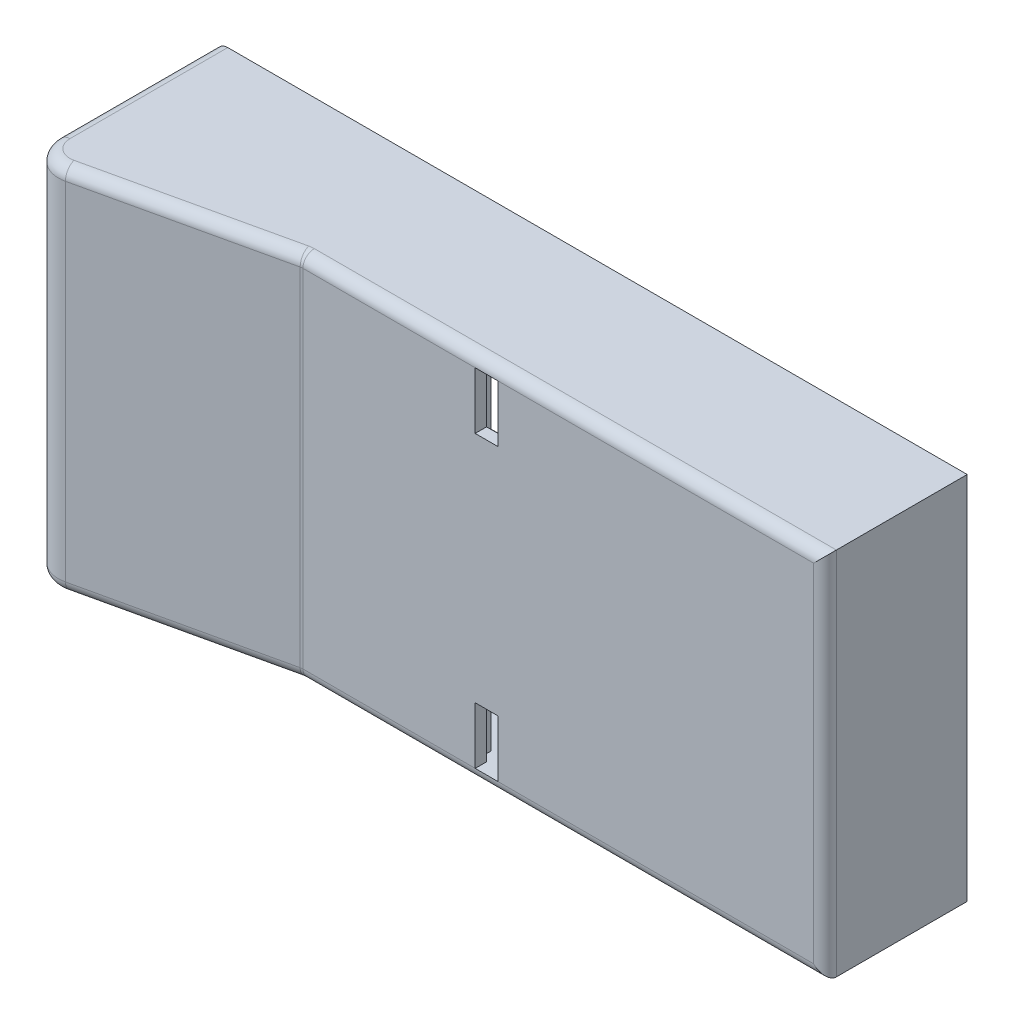
from build123d import *

# Parameters (mm, degrees)
BOSS_EXTRUDE3_DEPTH = 65
BOSS_EXTRUDE4_REACH = 153.013
SKETCH4_W           = 128
SKETCH4_H           = 2
SKETCH5_W           = 12
SKETCH5_H           = 53.559358602
CUT_EXTRUDE2_DEPTH  = 11
FILLET1_R           = 5
FILLET2_R           = 2
SKETCH7_W           = 90
SKETCH7_H           = 61
BOSS_EXTRUDE5_DEPTH = 2
BOSS_EXTRUDE6_DEPTH = 5
SKETCH12_R          = 1.5
CUT_EXTRUDE5_DEPTH  = 20
BOSS_EXTRUDE7_START = 13
BOSS_EXTRUDE7_DEPTH = 13
SKETCH15_R          = 1.5
CUT_EXTRUDE6_DEPTH  = 21
SKETCH16_W          = 6.5
SKETCH16_H          = 61
CUT_EXTRUDE7_DEPTH  = 2
FILLET3_R           = 3
FILLET4_R           = 3
CUT_EXTRUDE9_DEPTH  = 2
SKETCH18_W          = 6.5
SKETCH18_H          = 37.103743482
BOSS_EXTRUDE8_DEPTH = 2


with BuildPart() as part:
    # Sketch3 → Boss-Extrude3 (new body)
    with BuildSketch(Plane(origin=(0, 0, 0), x_dir=(1, 0, 0), z_dir=(0, 1, 0))):
        Polygon((0, 0), (0, 25), (-2, 25), (-2, 2), (-92, 2), (-130, -6.55), (-130, 25), (-132, 25), (-132, -9), (-92, 0), align=None)
    extrude(amount=BOSS_EXTRUDE3_DEPTH)

    # Sketch4 → Boss-Extrude4 (add, up to next)
    with BuildSketch(Plane(origin=(0, 0, -25), x_dir=(-1, 0, 0), z_dir=(0, 0, -1)), mode=Mode.PRIVATE) as boss_extrude4_sk1:
        with Locations((66, 64)):
            Rectangle(SKETCH4_W, SKETCH4_H)
    boss_extrude4_tool1 = extrude(boss_extrude4_sk1.sketch, amount=-BOSS_EXTRUDE4_REACH, mode=Mode.PRIVATE) - part.part
    # Sketch4 → Boss-Extrude4 (add, up to next)
    with BuildSketch(Plane(origin=(0, 0, -25), x_dir=(-1, 0, 0), z_dir=(0, 0, -1)), mode=Mode.PRIVATE) as boss_extrude4_sk2:
        with Locations((66, 1)):
            Rectangle(SKETCH4_W, SKETCH4_H)
    boss_extrude4_tool2 = extrude(boss_extrude4_sk2.sketch, amount=-BOSS_EXTRUDE4_REACH, mode=Mode.PRIVATE) - part.part
    add(boss_extrude4_tool1.solids().sort_by_distance((-66, 64, -25))[0])
    add(boss_extrude4_tool2.solids().sort_by_distance((-66, 1, -25))[0])

    # Sketch5 → Cut-Extrude2 (cut)
    with BuildSketch(Plane.ZY.offset(132)):
        with Locations((-14, 32.5)):
            Rectangle(SKETCH5_W, SKETCH5_H)
    extrude(amount=-CUT_EXTRUDE2_DEPTH, mode=Mode.SUBTRACT)

    # Fillet1
    fillet1_edges = [part.edges().sort_by_distance(p)[0] for p in [
        (-132, 32.5, 9),
    ]]
    fillet(fillet1_edges, radius=FILLET1_R)

    # Fillet2
    fillet2_edges = [part.edges().sort_by_distance(p)[0] for p in [
        (-132, 0, -11.125),
        (-46, 0, 0),
        (-92, 32.5, 0),
        (0, 32.5, 0),
        (-132, 65, -11.125),
        (-46, 65, 0),
        (-108.951219512, 0, 3.81402439),
        (-108.951219512, 65, 3.81402439),
        (-130.123475238, 0, 6.654344047),
        (-130.123475238, 65, 6.654344047),
    ]]
    fillet(fillet2_edges, radius=FILLET2_R)

    # Sketch7 → Boss-Extrude5 (add)
    with BuildSketch(Plane(origin=(0, 0, -2), x_dir=(-1, 0, 0), z_dir=(0, 0, -1))):
        with Locations((47, 32.5)):
            Rectangle(SKETCH7_W, SKETCH7_H)
    extrude(amount=BOSS_EXTRUDE5_DEPTH)

    # Sketch11 → Boss-Extrude6 (add)
    with BuildSketch(Plane(origin=(0, 0, -25), x_dir=(-1, 0, 0), z_dir=(0, 0, -1))):
        with BuildLine():
            Line((7, 63), (2, 63))
            Line((2, 63), (2, 58))
            ThreePointArc((2, 58), (5.535533906, 59.464466094), (7, 63))
        make_face()
        with BuildLine():
            Line((2, 7), (2, 2))
            Line((2, 2), (7, 2))
            ThreePointArc((7, 2), (5.535533906, 5.535533906), (2, 7))
        make_face()
        with BuildLine():
            Line((125, 2), (130, 2))
            Line((130, 2), (130, 7))
            ThreePointArc((130, 7), (126.464466094, 5.535533906), (125, 2))
        make_face()
        with BuildLine():
            Line((125, 63), (130, 63))
            Line((130, 63), (130, 58))
            ThreePointArc((130, 58), (126.464466094, 59.464466094), (125, 63))
        make_face()
    extrude(amount=-BOSS_EXTRUDE6_DEPTH)

    # Sketch12 → Cut-Extrude5 (cut)
    with BuildSketch(Plane(origin=(0, 0, -25), x_dir=(-1, 0, 0), z_dir=(0, 0, -1))):
        with Locations((3.767766953, 61.232233047)):
            Circle(SKETCH12_R)
        with Locations((128.232233047, 61.232233047)):
            Circle(SKETCH12_R)
        with Locations((128.232233047, 3.767766953)):
            Circle(SKETCH12_R)
        with Locations((3.767766953, 3.767766953)):
            Circle(SKETCH12_R)
    extrude(amount=-CUT_EXTRUDE5_DEPTH, mode=Mode.SUBTRACT)

    # Sketch14 → Boss-Extrude7 (add)
    with BuildSketch(Plane(origin=(0, 0, -4), x_dir=(-1, 0, 0), z_dir=(0, 0, -1)).offset(BOSS_EXTRUDE7_START)):
        with BuildLine():
            Line((2, 58), (2, 63))
            Line((2, 63), (7, 63))
            ThreePointArc((7, 63), (5.535533906, 59.464466094), (2, 58))
        make_face()
        with BuildLine():
            Line((2, 2), (7, 2))
            ThreePointArc((7, 2), (5.535533906, 5.535533906), (2, 7))
            Line((2, 7), (2, 2))
        make_face()
    extrude(amount=-BOSS_EXTRUDE7_DEPTH)

    # Sketch15 → Cut-Extrude6 (cut)
    with BuildSketch(Plane(origin=(0, 0, -25), x_dir=(-1, 0, 0), z_dir=(0, 0, -1))):
        with Locations((3.767766953, 3.767766953)):
            Circle(SKETCH15_R)
        with Locations((3.767766953, 61.232233047)):
            Circle(SKETCH15_R)
    extrude(amount=-CUT_EXTRUDE6_DEPTH, mode=Mode.SUBTRACT)

    # Sketch16 → Cut-Extrude7 (cut)
    with BuildSketch(Plane(origin=(0, 0, -4), x_dir=(-1, 0, 0), z_dir=(0, 0, -1))):
        with Locations((59.5, 32.5)):
            Rectangle(SKETCH16_W, SKETCH16_H)
    extrude(amount=-CUT_EXTRUDE7_DEPTH, mode=Mode.SUBTRACT)

    # Fillet3
    # the kernel refuses this fillet: 3 mm, written as the material it adds along each edge
    with BuildSketch(Plane(origin=(-92, 2, -2), x_dir=(-2.9487523534032267e-12, 0, -1.0), z_dir=(0, 1, 0))) as fillet3_piece_1:
        with BuildLine():
            CenterArc((2.406216573, 2.972370787), FILLET3_R, 192.680383492, 69.537546468)
            Line((-0.520612695, 2.313834202), (-0.579149281, 2.30066347))
            Line((-0.579149281, 2.30066347), (-0.058536585, -0.013170732))
            Line((-0.058536585, -0.013170732), (0, -0.06))
            ThreePointArc((0, -0.06), (1, -0.06), (1.991875669, -0.059447416))
            Line((1.991875669, -0.059447416), (2, 0))
        make_face()
    extrude(amount=61)

    # Fillet4
    fillet4_edges = [part.edges().sort_by_distance(p)[0] for p in [
        (-92, 32.5, -4),
    ]]
    fillet(fillet4_edges, radius=FILLET4_R)

    # Sketch17 → Cut-Extrude9 (cut)
    with BuildSketch(Plane(origin=(0, 0, -2), x_dir=(-1, 0, 0), z_dir=(0, 0, -1))):
        Polygon((59.5, 53), (61.5, 53), (61.5, 63), (57.5, 63), (57.5, 53), align=None)
        Polygon((57.5, 2), (61.5, 2), (61.5, 12), (59.5, 12), (57.5, 12), align=None)
    extrude(amount=-CUT_EXTRUDE9_DEPTH, mode=Mode.SUBTRACT)

    # Sketch18 → Boss-Extrude8 (add)
    with BuildSketch(Plane(origin=(0, 0, -2), x_dir=(-1, 0, 0), z_dir=(0, 0, -1))):
        with Locations((59.5, 32.5)):
            Rectangle(SKETCH18_W, SKETCH18_H)
    extrude(amount=BOSS_EXTRUDE8_DEPTH)


solid = part.part
